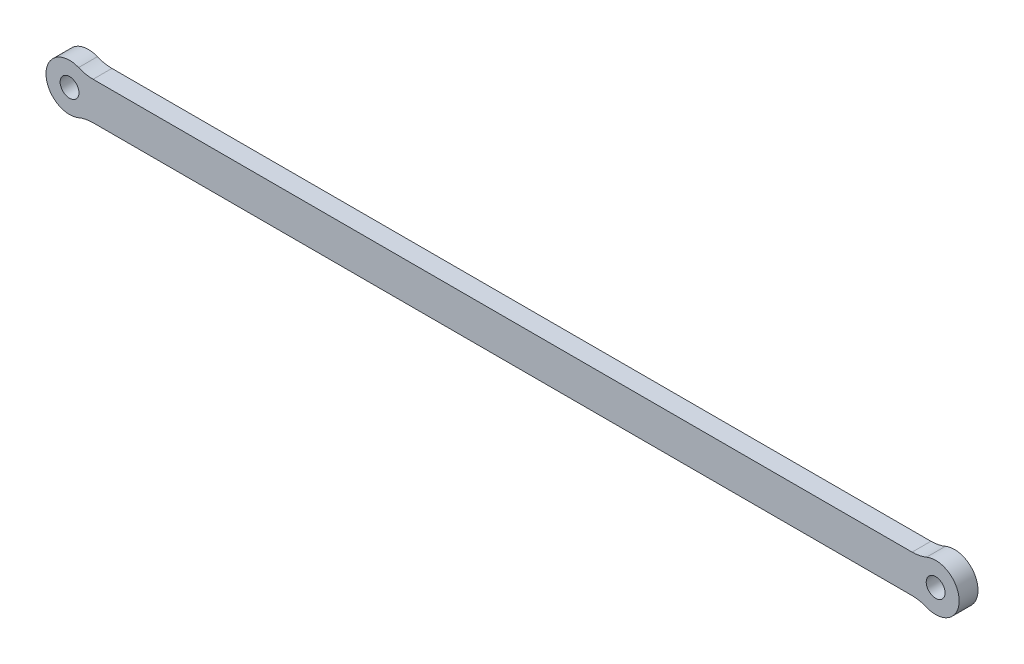
from build123d import *

# Parameters (mm, degrees)
SKIZZE1_R                       = 2.5
AUFSATZ_LINEAR_AUSTRAGEN1_DEPTH = 5


with BuildPart() as part:
    # Skizze1 → Aufsatz-Linear austragen1 (new body)
    with BuildSketch(Plane.XY):
        with BuildLine():
            Line((108.75, 5), (-108.75, 5))
            ThreePointArc((-108.75, 5), (-110.711161351, 5.194193243), (-112.596153846, 5.769230769))
            ThreePointArc((-112.596153846, 5.769230769), (-121.25, 0), (-112.596153846, -5.769230769))
            ThreePointArc((-112.596153846, -5.769230769), (-110.711161351, -5.194193243), (-108.75, -5))
            Line((-108.75, -5), (108.75, -5))
            ThreePointArc((108.75, -5), (110.711161351, -5.194193243), (112.596153846, -5.769230769))
            ThreePointArc((112.596153846, -5.769230769), (121.25, 0), (112.596153846, 5.769230769))
            ThreePointArc((112.596153846, 5.769230769), (110.711161351, 5.194193243), (108.75, 5))
        make_face()
        with Locations((-115, 0)):
            Circle(SKIZZE1_R, mode=Mode.SUBTRACT)
        with Locations((115, 0)):
            Circle(SKIZZE1_R, mode=Mode.SUBTRACT)
    extrude(amount=AUFSATZ_LINEAR_AUSTRAGEN1_DEPTH)


solid = part.part
